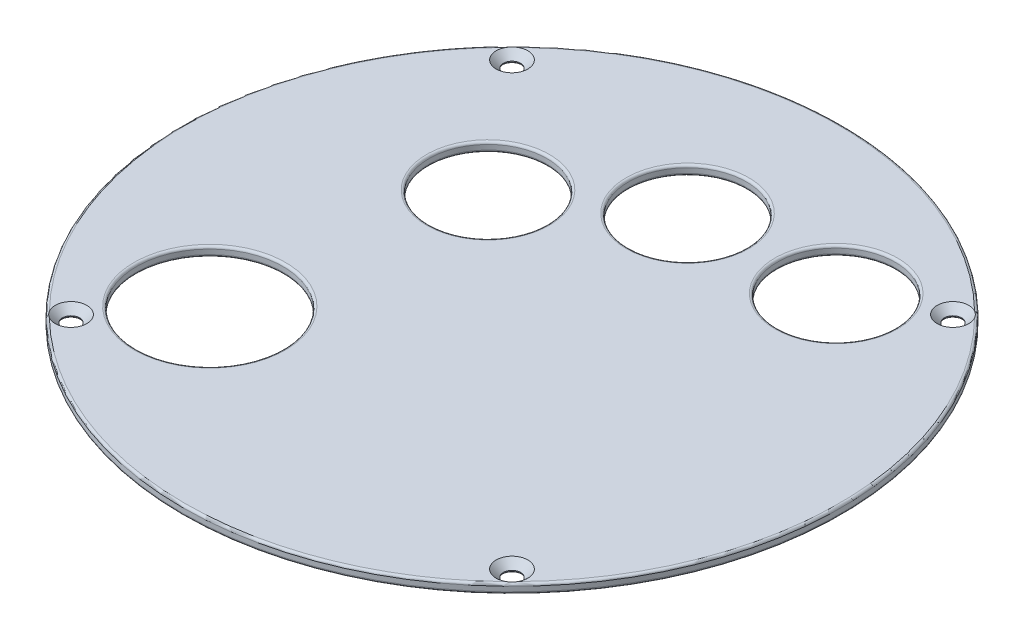
from build123d import *

# Parameters (mm, degrees)
SKETCH1_R           = 68.7
SKETCH1_R_2         = 1.8
SKETCH1_R_3         = 12.3
SKETCH1_R_4         = 15.3
BOSS_EXTRUDE1_DEPTH = 2
CHAMFER3_SIZE       = 1.5
FILLET1_R           = 0.5


with BuildPart() as part:
    # Sketch1 → Boss-Extrude1 (new body)
    with BuildSketch(Plane(origin=(0, 0, 0), x_dir=(1, 0, 0), z_dir=(0, 1, 0))):
        with Locations(Location((0, 0, 0), (0, 0, 270))):
            Circle(SKETCH1_R)
        with Locations(Location((-45.961940777, 45.961940777, 0), (0, 0, 270))):
            Circle(SKETCH1_R_2, mode=Mode.SUBTRACT)
        with Locations(Location((45.961940777, 45.961940777, 0), (0, 0, 270))):
            Circle(SKETCH1_R_2, mode=Mode.SUBTRACT)
        with Locations(Location((45.961940777, -45.961940777, 0), (0, 0, 270))):
            Circle(SKETCH1_R_2, mode=Mode.SUBTRACT)
        with Locations(Location((-45.961940777, -45.961940777, 0), (0, 0, 270))):
            Circle(SKETCH1_R_2, mode=Mode.SUBTRACT)
        with Locations(Location((-25, 20, 0), (0, 0, 270))):
            Circle(SKETCH1_R_3, mode=Mode.SUBTRACT)
        with Locations(Location((0, 36.583123952, 0), (0, 0, 270))):
            Circle(SKETCH1_R_3, mode=Mode.SUBTRACT)
        with Locations(Location((30, 37.583123952, 0), (0, 0, 270))):
            Circle(SKETCH1_R_3, mode=Mode.SUBTRACT)
        with Locations(Location((-33, -30, 0), (0, 0, 270))):
            Circle(SKETCH1_R_4, mode=Mode.SUBTRACT)
    extrude(amount=BOSS_EXTRUDE1_DEPTH)

    # Chamfer3
    chamfer3_edges = [part.edges().sort_by_distance(p)[0] for p in [
        (-45.961940777, 2, 44.161940777),
        (45.961940777, 2, 44.161940777),
        (45.961940777, 2, -47.761940777),
        (-45.961940777, 2, -47.761940777),
    ]]
    chamfer(chamfer3_edges, length=CHAMFER3_SIZE)

    # Fillet1
    # the kernel refuses this fillet: 0.5 mm, written as the material it takes off along each edge
    with BuildSketch(Plane(origin=(0, 0, 0), x_dir=(0, 0, 1), z_dir=(-1, 0, 0))) as fillet1_piece_1:
        with BuildLine():
            CenterArc((68.2001, 0.4999), FILLET1_R, 270, 90)
            Line((68.7001, 0.4999), (68.7101, 0.4999))
            ThreePointArc((68.7101, 0.4999), (68.71, 0.24995), (68.71, 0))
            Line((68.71, 0), (68.7, -0.01))
            ThreePointArc((68.7, -0.01), (68.45005, -0.01), (68.2001, -0.0101))
            Line((68.2001, -0.0101), (68.2001, -0.0001))
        make_face()
    revolve(axis=Axis((0, 0, 0), (0, 1, 0)), mode=Mode.SUBTRACT)
    with BuildSketch(Plane(origin=(-45.961940777, 0, -45.961940777), x_dir=(0, 0, 1), z_dir=(-1, 0, 0))) as fillet1_piece_2:
        with BuildLine():
            CenterArc((2.2999, 0.4999), FILLET1_R, 180, 90)
            Line((2.2999, -0.0001), (2.2999, -0.0101))
            ThreePointArc((2.2999, -0.0101), (2.04995, -0.01), (1.8, -0.01))
            Line((1.8, -0.01), (1.79, 0))
            ThreePointArc((1.79, 0), (1.79, 0.24995), (1.7899, 0.4999))
            Line((1.7899, 0.4999), (1.7999, 0.4999))
        make_face()
    revolve(axis=Axis((-45.961940777, 0, -45.961940777), (0, 1, 0)), mode=Mode.SUBTRACT)
    with BuildSketch(Plane(origin=(45.961940777, 0, -45.961940777), x_dir=(0, 0, 1), z_dir=(-1, 0, 0))) as fillet1_piece_3:
        with BuildLine():
            CenterArc((2.2999, 0.4999), FILLET1_R, 180, 90)
            Line((1.7999, 0.4999), (1.7899, 0.4999))
            ThreePointArc((1.7899, 0.4999), (1.79, 0.24995), (1.79, 0))
            Line((1.79, 0), (1.8, -0.01))
            ThreePointArc((1.8, -0.01), (2.04995, -0.01), (2.2999, -0.0101))
            Line((2.2999, -0.0101), (2.2999, -0.0001))
        make_face()
    revolve(axis=Axis((45.961940777, 0, -45.961940777), (0, 1, 0)), mode=Mode.SUBTRACT)
    with BuildSketch(Plane(origin=(45.961940777, 0, 45.961940777), x_dir=(0, 0, 1), z_dir=(-1, 0, 0))) as fillet1_piece_4:
        with BuildLine():
            CenterArc((2.2999, 0.4999), FILLET1_R, 180, 90)
            Line((1.7999, 0.4999), (1.7899, 0.4999))
            ThreePointArc((1.7899, 0.4999), (1.79, 0.24995), (1.79, 0))
            Line((1.79, 0), (1.8, -0.01))
            ThreePointArc((1.8, -0.01), (2.04995, -0.01), (2.2999, -0.0101))
            Line((2.2999, -0.0101), (2.2999, -0.0001))
        make_face()
    revolve(axis=Axis((45.961940777, 0, 45.961940777), (0, 1, 0)), mode=Mode.SUBTRACT)
    with BuildSketch(Plane(origin=(-33, 2, 30), x_dir=(0, 0, 1), z_dir=(-1, 0, 0))) as fillet1_piece_5:
        with BuildLine():
            CenterArc((15.7999, -0.4999), FILLET1_R, 90, 90)
            Line((15.2999, -0.4999), (15.2899, -0.4999))
            ThreePointArc((15.2899, -0.4999), (15.29, -0.24995), (15.29, 0))
            Line((15.29, 0), (15.3, 0.01))
            ThreePointArc((15.3, 0.01), (15.54995, 0.01), (15.7999, 0.0101))
            Line((15.7999, 0.0101), (15.7999, 0.0001))
        make_face()
    revolve(axis=Axis((-33, 2, 30), (0, 1, 0)), mode=Mode.SUBTRACT)
    with BuildSketch(Plane(origin=(-45.961940777, 0, 45.961940777), x_dir=(0, 0, 1), z_dir=(-1, 0, 0))) as fillet1_piece_6:
        with BuildLine():
            CenterArc((2.2999, 0.4999), FILLET1_R, 180, 90)
            Line((1.7999, 0.4999), (1.7899, 0.4999))
            ThreePointArc((1.7899, 0.4999), (1.79, 0.24995), (1.79, 0))
            Line((1.79, 0), (1.8, -0.01))
            ThreePointArc((1.8, -0.01), (2.04995, -0.01), (2.2999, -0.0101))
            Line((2.2999, -0.0101), (2.2999, -0.0001))
        make_face()
    revolve(axis=Axis((-45.961940777, 0, 45.961940777), (0, 1, 0)), mode=Mode.SUBTRACT)
    with BuildSketch(Plane(origin=(-25, 0, -20), x_dir=(0, 0, 1), z_dir=(-1, 0, 0))) as fillet1_piece_7:
        with BuildLine():
            CenterArc((12.7999, 0.4999), FILLET1_R, 180, 90)
            Line((12.2999, 0.4999), (12.2899, 0.4999))
            ThreePointArc((12.2899, 0.4999), (12.29, 0.24995), (12.29, 0))
            Line((12.29, 0), (12.3, -0.01))
            ThreePointArc((12.3, -0.01), (12.54995, -0.01), (12.7999, -0.0101))
            Line((12.7999, -0.0101), (12.7999, -0.0001))
        make_face()
    revolve(axis=Axis((-25, 0, -20), (0, 1, 0)), mode=Mode.SUBTRACT)
    with BuildSketch(Plane(origin=(0, 0, -36.583123952), x_dir=(0, 0, 1), z_dir=(-1, 0, 0))) as fillet1_piece_8:
        with BuildLine():
            CenterArc((12.7999, 0.4999), FILLET1_R, 180, 90)
            Line((12.2999, 0.4999), (12.2899, 0.4999))
            ThreePointArc((12.2899, 0.4999), (12.29, 0.24995), (12.29, 0))
            Line((12.29, 0), (12.3, -0.01))
            ThreePointArc((12.3, -0.01), (12.54995, -0.01), (12.7999, -0.0101))
            Line((12.7999, -0.0101), (12.7999, -0.0001))
        make_face()
    revolve(axis=Axis((0, 0, -36.583123952), (0, 1, 0)), mode=Mode.SUBTRACT)
    with BuildSketch(Plane(origin=(30, 0, -37.583123952), x_dir=(0, 0, 1), z_dir=(-1, 0, 0))) as fillet1_piece_9:
        with BuildLine():
            CenterArc((12.7999, 0.4999), FILLET1_R, 180, 90)
            Line((12.2999, 0.4999), (12.2899, 0.4999))
            ThreePointArc((12.2899, 0.4999), (12.29, 0.24995), (12.29, 0))
            Line((12.29, 0), (12.3, -0.01))
            ThreePointArc((12.3, -0.01), (12.54995, -0.01), (12.7999, -0.0101))
            Line((12.7999, -0.0101), (12.7999, -0.0001))
        make_face()
    revolve(axis=Axis((30, 0, -37.583123952), (0, 1, 0)), mode=Mode.SUBTRACT)
    with BuildSketch(Plane(origin=(-33, 0, 30), x_dir=(0, 0, 1), z_dir=(-1, 0, 0))) as fillet1_piece_10:
        with BuildLine():
            CenterArc((15.7999, 0.4999), FILLET1_R, 180, 90)
            Line((15.2999, 0.4999), (15.2899, 0.4999))
            ThreePointArc((15.2899, 0.4999), (15.29, 0.24995), (15.29, 0))
            Line((15.29, 0), (15.3, -0.01))
            ThreePointArc((15.3, -0.01), (15.54995, -0.01), (15.7999, -0.0101))
            Line((15.7999, -0.0101), (15.7999, -0.0001))
        make_face()
    revolve(axis=Axis((-33, 0, 30), (0, 1, 0)), mode=Mode.SUBTRACT)
    with BuildSketch(Plane(origin=(30, 2, -37.583123952), x_dir=(0, 0, 1), z_dir=(-1, 0, 0))) as fillet1_piece_11:
        with BuildLine():
            CenterArc((12.7999, -0.4999), FILLET1_R, 90, 90)
            Line((12.2999, -0.4999), (12.2899, -0.4999))
            ThreePointArc((12.2899, -0.4999), (12.29, -0.24995), (12.29, 0))
            Line((12.29, 0), (12.3, 0.01))
            ThreePointArc((12.3, 0.01), (12.54995, 0.01), (12.7999, 0.0101))
            Line((12.7999, 0.0101), (12.7999, 0.0001))
        make_face()
    revolve(axis=Axis((30, 2, -37.583123952), (0, 1, 0)), mode=Mode.SUBTRACT)
    with BuildSketch(Plane(origin=(0, 2, -36.583123952), x_dir=(0, 0, 1), z_dir=(-1, 0, 0))) as fillet1_piece_12:
        with BuildLine():
            CenterArc((12.7999, -0.4999), FILLET1_R, 90, 90)
            Line((12.2999, -0.4999), (12.2899, -0.4999))
            ThreePointArc((12.2899, -0.4999), (12.29, -0.24995), (12.29, 0))
            Line((12.29, 0), (12.3, 0.01))
            ThreePointArc((12.3, 0.01), (12.54995, 0.01), (12.7999, 0.0101))
            Line((12.7999, 0.0101), (12.7999, 0.0001))
        make_face()
    revolve(axis=Axis((0, 2, -36.583123952), (0, 1, 0)), mode=Mode.SUBTRACT)
    with BuildSketch(Plane(origin=(-25, 2, -20), x_dir=(0, 0, 1), z_dir=(-1, 0, 0))) as fillet1_piece_13:
        with BuildLine():
            CenterArc((12.7999, -0.4999), FILLET1_R, 90, 90)
            Line((12.2999, -0.4999), (12.2899, -0.4999))
            ThreePointArc((12.2899, -0.4999), (12.29, -0.24995), (12.29, 0))
            Line((12.29, 0), (12.3, 0.01))
            ThreePointArc((12.3, 0.01), (12.54995, 0.01), (12.7999, 0.0101))
            Line((12.7999, 0.0101), (12.7999, 0.0001))
        make_face()
    revolve(axis=Axis((-25, 2, -20), (0, 1, 0)), mode=Mode.SUBTRACT)
    with BuildSketch(Plane(origin=(0, 2, 0), x_dir=(0, 0, 1), z_dir=(-1, 0, 0))) as fillet1_piece_14:
        with BuildLine():
            CenterArc((68.2001, -0.4999), FILLET1_R, 0, 90)
            Line((68.7001, -0.4999), (68.7101, -0.4999))
            ThreePointArc((68.7101, -0.4999), (68.71, -0.24995), (68.71, 0))
            Line((68.71, 0), (68.7, 0.01))
            ThreePointArc((68.7, 0.01), (68.45005, 0.01), (68.2001, 0.0101))
            Line((68.2001, 0.0101), (68.2001, 0.0001))
        make_face()
    revolve(axis=Axis((0, 2, 0), (0, 1, 0)), mode=Mode.SUBTRACT)


solid = part.part
